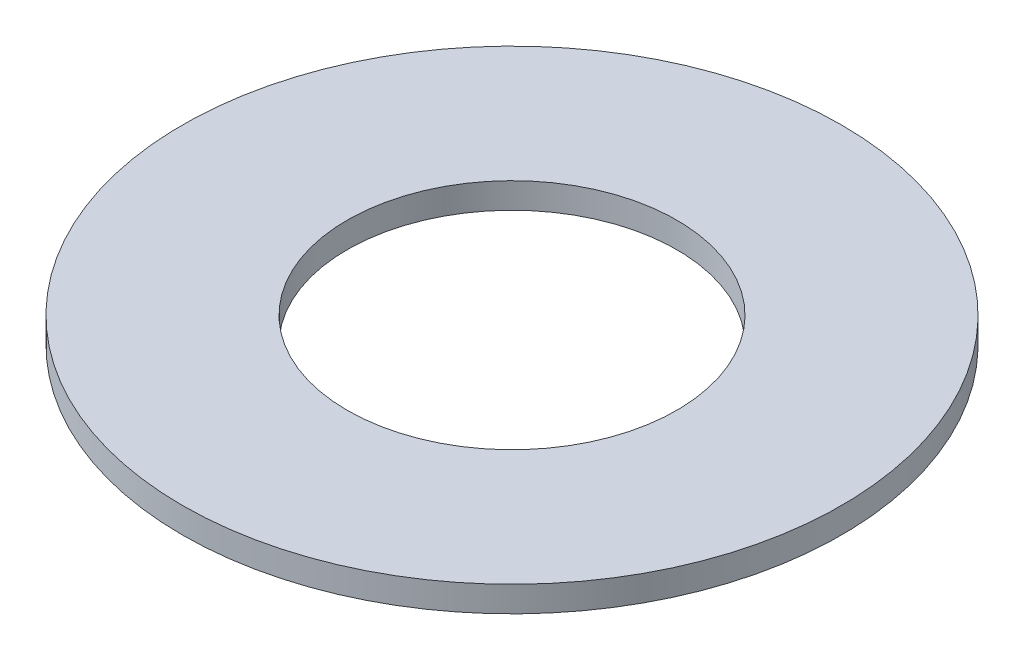
from build123d import *

# Parameters (mm, degrees)
SKETCH1_R           = 90
BOSS_EXTRUDE1_DEPTH = 7
SKETCH2_R           = 45
CUT_EXTRUDE1_DEPTH  = 128.471565457


with BuildPart() as part:
    # Sketch1 → Boss-Extrude1 (new body)
    with BuildSketch(Plane(origin=(0, 0, 0), x_dir=(1, 0, 0), z_dir=(0, 1, 0))):
        Circle(SKETCH1_R)
    extrude(amount=BOSS_EXTRUDE1_DEPTH)

    # Sketch2 → Cut-Extrude1 (cut, through all)
    with BuildSketch(Plane(origin=(0, 0, 0), x_dir=(1, 0, 0), z_dir=(0, 1, 0))):
        Circle(SKETCH2_R)
    extrude(amount=CUT_EXTRUDE1_DEPTH, mode=Mode.SUBTRACT)


solid = part.part
